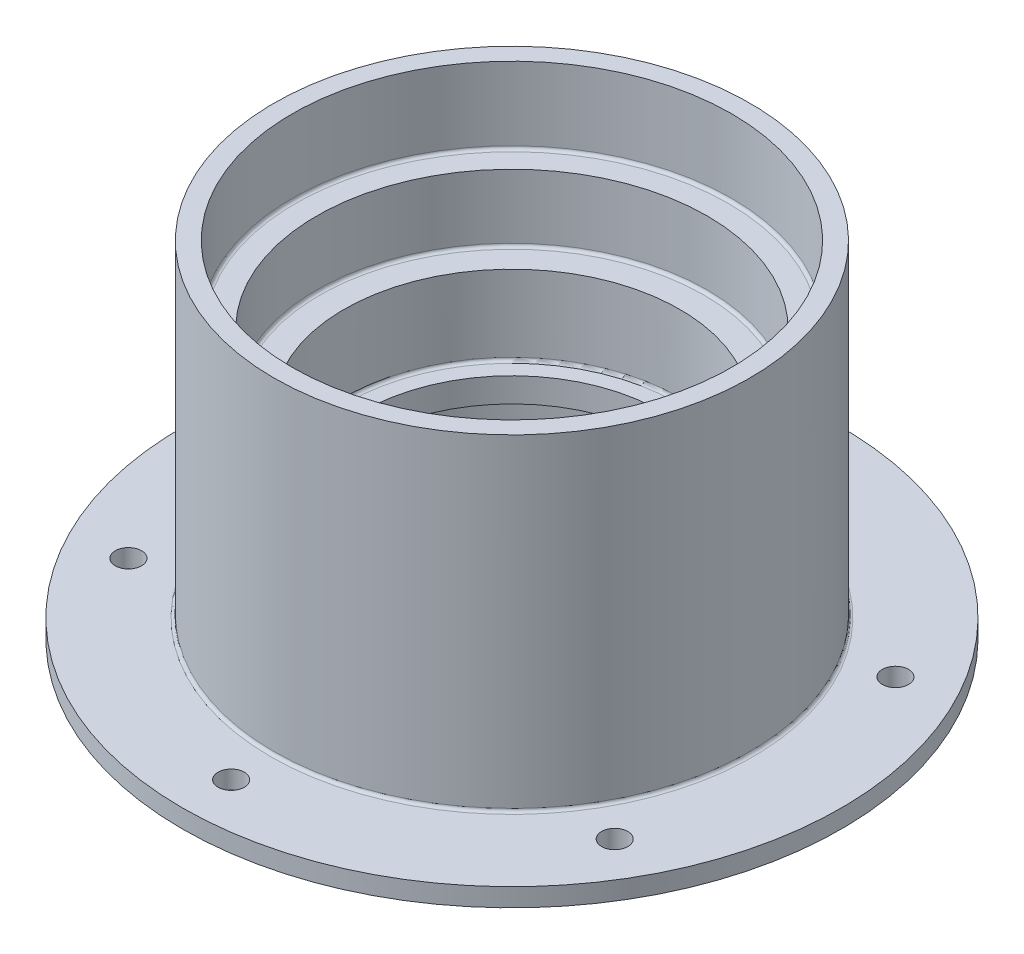
from build123d import *

# Parameters (mm, degrees)
M4_CLEARANCE_HOLE1_D     = 4.3
M4_CLEARANCE_HOLE1_DEPTH = 100
M4_CLEARANCE_HOLE1_TIP   = 1.291850331
CUT_EXTRUDE1_DEPTH       = 10
FILLET1_R                = 0.5


with BuildPart() as part:
    # Sketch1 → Revolve1 (revolve)
    with BuildSketch(Plane.XY):
        Polygon((-37, -3), (-39, -3), (-39, -56.5), (-54, -56.5), (-54, -59.5), (-32, -59.5), (-32, -43.5), (-24.5, -43.5), (-24.5, -39.5), (-27.5, -39.5), (-27.5, -26.5), (-32, -26.5), (-32, -15.5), (-36, -15.5), (-36, -3), align=None)
    revolve(axis=Axis((0, 0, 0), (0, -1, 0)))

    # M4 Clearance Hole1
    with Locations(Plane(origin=(0, -56.5, 0), x_dir=(1, 0, 0), z_dir=(0, 1, 0))):
        with Locations((0, 46), (39.837168574, 23), (39.837168574, -23), (0, -46), (-39.837168574, -23), (-39.837168574, 23)):
            Hole(M4_CLEARANCE_HOLE1_D / 2, depth=M4_CLEARANCE_HOLE1_DEPTH)
            with Locations((0, 0, -(M4_CLEARANCE_HOLE1_DEPTH + M4_CLEARANCE_HOLE1_TIP / 2))):  # 118° drill point
                Cone(0, M4_CLEARANCE_HOLE1_D / 2, M4_CLEARANCE_HOLE1_TIP, mode=Mode.SUBTRACT)

    # Sketch6 → Cut-Extrude1 (cut)
    with BuildSketch(Plane.XZ.offset(56.5)):
        with BuildLine():
            ThreePointArc((-15.184284639, -11), (-18.75, 0), (-15.184284639, 11))
            Line((-15.184284639, 11), (-28.447319733, 11))
            Line((-28.447319733, 11), (-37.416573868, 11))
            ThreePointArc((-37.416573868, 11), (-39, 0), (-37.416573868, -11))
            Line((-37.416573868, -11), (-28.447319733, -11))
            Line((-28.447319733, -11), (-15.184284639, -11))
        make_face()
    extrude(amount=-CUT_EXTRUDE1_DEPTH, mode=Mode.SUBTRACT)

    # Fillet1
    fillet1_edges = [part.edges().sort_by_distance(p)[0] for p in [
        (32, -43.5, 0),
        (32, -26.5, 0),
        (39, -56.5, 0),
        (27.5, -39.5, 0),
        (36, -15.5, 0),
    ]]
    fillet(fillet1_edges, radius=FILLET1_R)


solid = part.part
